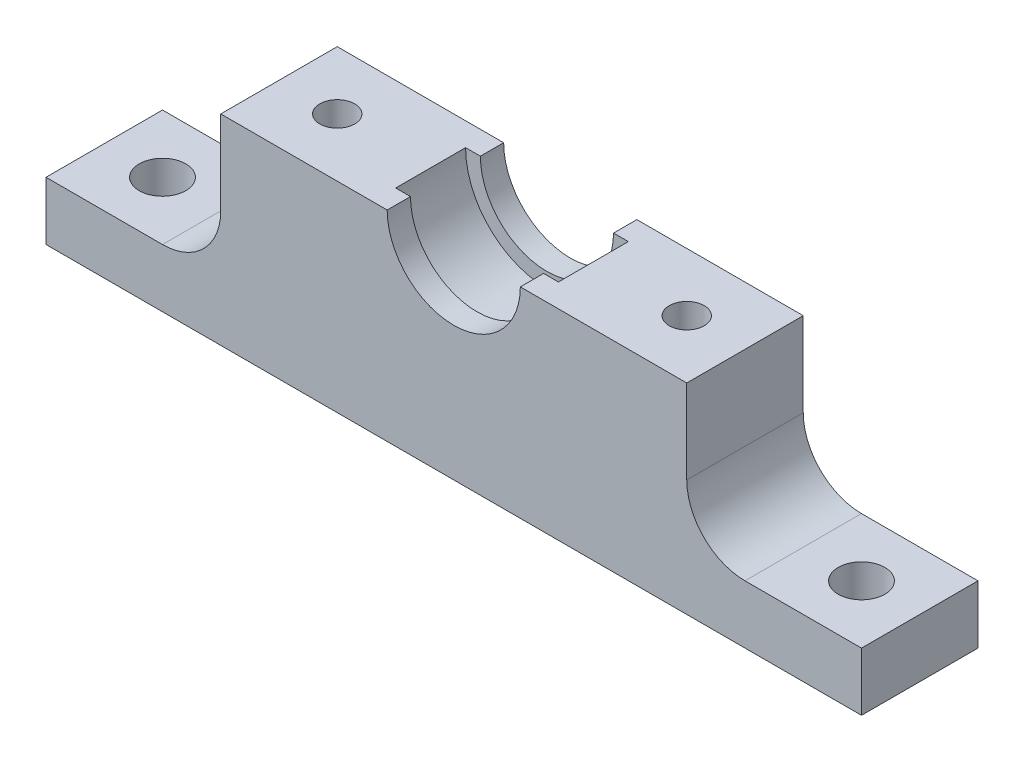
from build123d import *

# Parameters (mm, degrees)
SKETCH1_W           = 40
SKETCH1_H           = 10
BOSS_EXTRUDE1_DEPTH = 17.2098
CUT_EXTRUDE1_DEPTH  = 3
CUT_EXTRUDE2_DEPTH  = 5
SKETCH4_R           = 1.5
CUT_EXTRUDE3_DEPTH  = 7
SKETCH5_W           = 15
SKETCH5_H           = 10
SKETCH5_R           = 2
BOSS_EXTRUDE2_DEPTH = 5
FILLET1_R           = 5


with BuildPart() as part:
    # Sketch1 → Boss-Extrude1 (new body)
    with BuildSketch(Plane(origin=(0, 0, 0), x_dir=(1, 0, 0), z_dir=(0, 1, 0))):
        Rectangle(SKETCH1_W, SKETCH1_H)
    extrude(amount=BOSS_EXTRUDE1_DEPTH)

    # Sketch2 → Cut-Extrude1 (cut, symmetric)
    with BuildSketch(Plane(origin=(0, 0, 0), x_dir=(-1, 0, 0), z_dir=(0, 0, -1))):
        with BuildLine():
            Line((-6.985, 17.2098), (6.985, 17.2098))
            ThreePointArc((6.985, 17.2098), (0, 10.2248), (-6.985, 17.2098))
        make_face()
    extrude(amount=CUT_EXTRUDE1_DEPTH, both=True, mode=Mode.SUBTRACT)

    # Sketch3 → Cut-Extrude2 (cut, symmetric)
    with BuildSketch(Plane(origin=(0, 0, 0), x_dir=(-1, 0, 0), z_dir=(0, 0, -1))):
        with BuildLine():
            Line((-5.715, 17.2098), (5.715, 17.2098))
            ThreePointArc((5.715, 17.2098), (0, 11.4948), (-5.715, 17.2098))
        make_face()
    extrude(amount=CUT_EXTRUDE2_DEPTH, both=True, mode=Mode.SUBTRACT)

    # Sketch4 → Cut-Extrude3 (cut)
    with BuildSketch(Plane(origin=(0, 17.2098, 0), x_dir=(1, 0, 0), z_dir=(0, 1, 0))):
        with Locations((15, 0)):
            Circle(SKETCH4_R)
        with Locations((-15, 0)):
            Circle(SKETCH4_R)
    extrude(amount=-CUT_EXTRUDE3_DEPTH, mode=Mode.SUBTRACT)

    # Sketch5 → Boss-Extrude2 (add)
    # profile 1 of 2: a face of its own
    with BuildSketch(Plane.XZ):
        with Locations((-27.5, 0)):
            Rectangle(SKETCH5_W, SKETCH5_H)
        with Locations((-30, 0)):
            Circle(SKETCH5_R, mode=Mode.SUBTRACT)
    # profile 2 of 2: a face of its own
    with BuildSketch(Plane.XZ):
        with Locations((27.5, 0)):
            Rectangle(SKETCH5_W, SKETCH5_H)
        with Locations((30, 0)):
            Circle(SKETCH5_R, mode=Mode.SUBTRACT)
    extrude(amount=-BOSS_EXTRUDE2_DEPTH)

    # Fillet1
    fillet1_edges = [part.edges().sort_by_distance(p)[0] for p in [
        (-20, 5, 0),
        (20, 5, 0),
    ]]
    fillet(fillet1_edges, radius=FILLET1_R)


solid = part.part
